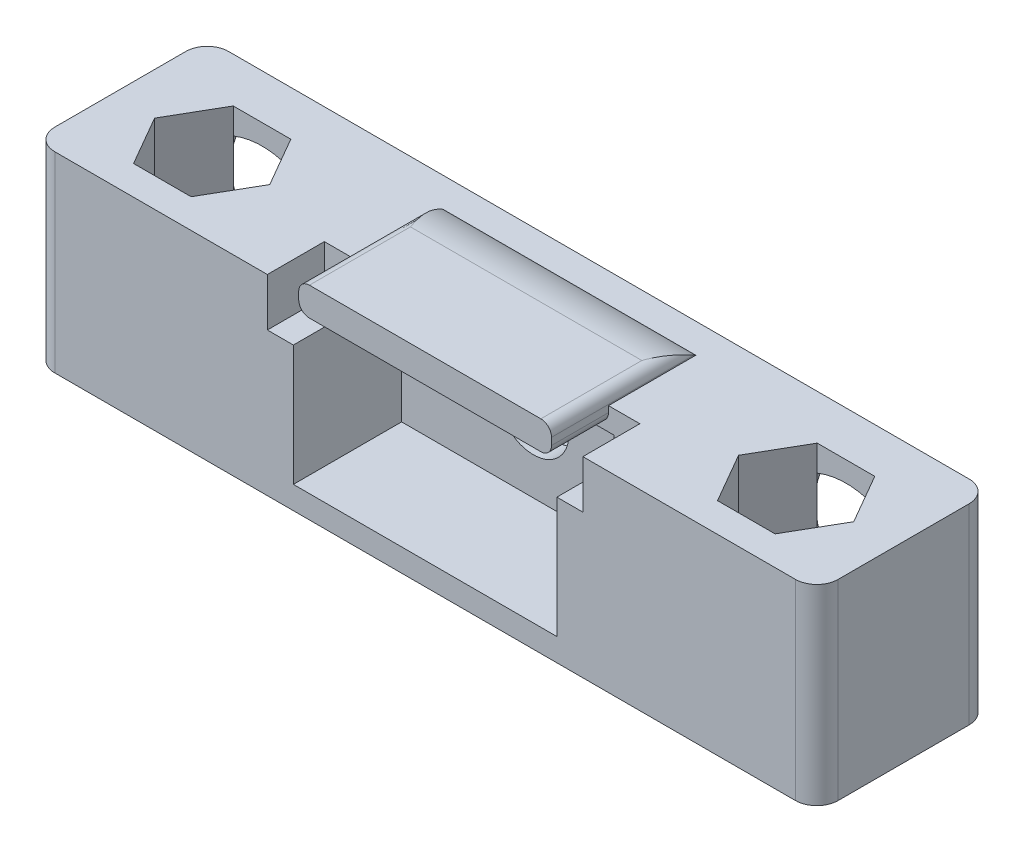
from build123d import *

# Parameters (mm, degrees)
SKETCH2_W           = 55
SKETCH2_H           = 13.45
BOSS_EXTRUDE1_DEPTH = 12.2
SKETCH3_W           = 18.5
SKETCH3_H           = 10.25
CUT_EXTRUDE1_DEPTH  = 7.6
SKETCH5_W           = 22.15
SKETCH5_H           = 1.6
CUT_EXTRUDE2_DEPTH  = 4
SKETCH6_W           = 17.75
SKETCH6_H           = 2
BOSS_EXTRUDE2_DEPTH = 8.7
SKETCH7_W           = 1.825
SKETCH7_H           = 3.375
CUT_EXTRUDE3_DEPTH  = 4
FILLET1_R           = 0.75
FILLET3_R           = 0.75
DRAFT4_ANGLE        = 60
FILLET5_R           = 6
SKETCH8_R           = 2.5
CUT_EXTRUDE4_DEPTH  = 58.328314378
SKETCH9_R           = 4.25
CUT_EXTRUDE5_DEPTH  = 3
SKETCH10_R          = 5.3
CUT_EXTRUDE6_DEPTH  = 3.15
CUT_EXTRUDE7_DEPTH  = 11
FILLET6_R           = 1.5


with BuildPart() as part:
    # Sketch2 → Boss-Extrude1 (new body)
    with BuildSketch(Plane.XY):
        with Locations((27.5, 6.725)):
            Rectangle(SKETCH2_W, SKETCH2_H)
    extrude(amount=BOSS_EXTRUDE1_DEPTH)

    # Sketch3 → Cut-Extrude1 (cut)
    with BuildSketch(Plane.XY.offset(12.2)):
        with Locations((27.5, 6.725)):
            Rectangle(SKETCH3_W, SKETCH3_H)
    extrude(amount=-CUT_EXTRUDE1_DEPTH, mode=Mode.SUBTRACT)

    # Sketch5 → Cut-Extrude2 (cut)
    with BuildSketch(Plane.XY.offset(12.2)):
        with Locations((27.5, 12.65)):
            Rectangle(SKETCH5_W, SKETCH5_H)
    extrude(amount=-CUT_EXTRUDE2_DEPTH, mode=Mode.SUBTRACT)

    # Sketch6 → Boss-Extrude2 (add)
    with BuildSketch(Plane.XY.offset(12.2)):
        with Locations((27.5, 13.275)):
            Rectangle(SKETCH6_W, SKETCH6_H)
    extrude(amount=-BOSS_EXTRUDE2_DEPTH)

    # Sketch7 → Cut-Extrude3 (cut)
    with BuildSketch(Plane.XY.offset(12.2)):
        with Locations((37.6625, 11.7625)):
            Rectangle(SKETCH7_W, SKETCH7_H)
        with Locations((17.3375, 11.7625)):
            Rectangle(SKETCH7_W, SKETCH7_H)
    extrude(amount=-CUT_EXTRUDE3_DEPTH, mode=Mode.SUBTRACT)

    # Fillet1
    fillet1_edges = [part.edges().sort_by_distance(p)[0] for p in [
        (36.375, 14.275, 7.85),
        (36.375, 12.275, 10.2),
    ]]
    fillet(fillet1_edges, radius=FILLET1_R)

    # Fillet3
    fillet3_edges = [part.edges().sort_by_distance(p)[0] for p in [
        (18.625, 12.275, 10.2),
        (18.625, 14.275, 7.85),
    ]]
    fillet(fillet3_edges, radius=FILLET3_R)

    # Draft4
    draft4_faces = [part.faces().sort_by_distance(p)[0] for p in [
        (27.5, 13.858393484, 3.5),
    ]]
    draft(draft4_faces, Plane(origin=(18.625, 14.275, 3.5), x_dir=(0, 0, 1), z_dir=(0, 1, 0)), DRAFT4_ANGLE)

    # Fillet5
    # the kernel refuses this fillet: 6 mm, written as the material it takes off along each edge
    with BuildSketch(Plane(origin=(39.644237886, 14.275, 3.5), x_dir=(0, -0.49999999999999806, -0.8660254037844397), z_dir=(-1, 0, 0))) as fillet5_piece_1:
        with BuildLine():
            CenterArc((FILLET5_R * 0.267949192431, FILLET5_R), FILLET5_R, 240, 30)
            Line((-FILLET5_R * 0.232050807569, FILLET5_R * 0.133974596216), (0, 0))
            Line((0, 0), (FILLET5_R * 0.267949192431, 0))
        make_face()
    extrude(amount=24.288475773, mode=Mode.SUBTRACT)

    # Sketch8 → Cut-Extrude4 (cut, through all)
    with BuildSketch(Plane.XY.offset(4.6)):
        with Locations((27.5, 6.725)):
            Circle(SKETCH8_R)
    extrude(amount=-CUT_EXTRUDE4_DEPTH, mode=Mode.SUBTRACT)

    # Sketch9 → Cut-Extrude5 (cut)
    with BuildSketch(Plane(origin=(0, 0, 0), x_dir=(-1, 0, 0), z_dir=(0, 0, -1))):
        with Locations((-27.5, 6.725)):
            Circle(SKETCH9_R)
    extrude(amount=-CUT_EXTRUDE5_DEPTH, mode=Mode.SUBTRACT)

    # Sketch10 → Cut-Extrude6 (cut)
    with BuildSketch(Plane(origin=(0, 0, 0), x_dir=(-1, 0, 0), z_dir=(0, 0, -1))):
        with Locations((-48, 6.725)):
            Circle(SKETCH10_R)
        with Locations((-7, 6.725)):
            Circle(SKETCH10_R)
    extrude(amount=-CUT_EXTRUDE6_DEPTH, mode=Mode.SUBTRACT)

    # Sketch11 → Cut-Extrude7 (cut)
    with BuildSketch(Plane(origin=(0, 13.45, 0), x_dir=(1, 0, 0), z_dir=(0, 1, 0))):
        Polygon((9.020725942, -3.15), (4.979274058, -3.15), (2.958548116, -6.65), (4.979274058, -10.15), (9.020725942, -10.15), (11.041451884, -6.65), align=None)
        Polygon((43.958548116, -6.65), (45.979274058, -3.15), (50.020725942, -3.15), (52.041451884, -6.65), (50.020725942, -10.15), (45.979274058, -10.15), align=None)
    extrude(amount=-CUT_EXTRUDE7_DEPTH, mode=Mode.SUBTRACT)

    # Fillet6
    fillet6_edges = [part.edges().sort_by_distance(p)[0] for p in [
        (55, 6.725, 12.2),
        (0, 6.725, 12.2),
        (55, 6.725, 0),
        (0, 6.725, 0),
    ]]
    fillet(fillet6_edges, radius=FILLET6_R)


solid = part.part
